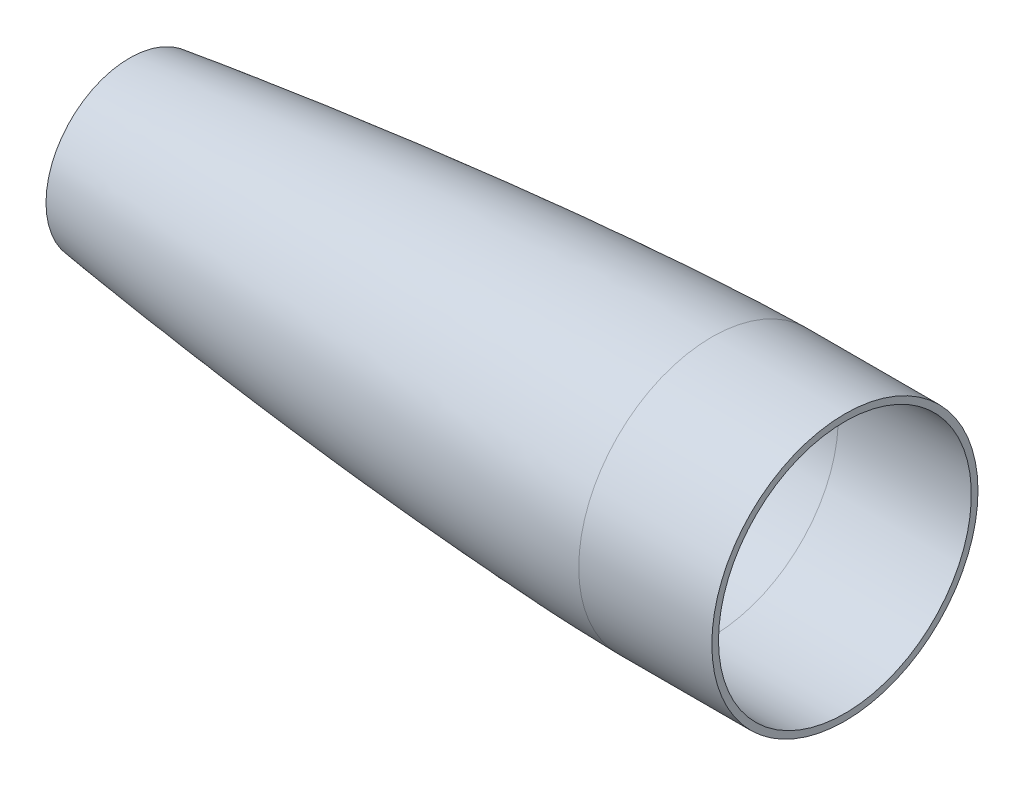
from build123d import *

# Parameters (mm, degrees)
SKETCH3_R          = 3.1
CUT_EXTRUDE1_DEPTH = 223.31734079


with BuildPart() as part:
    # Sketch2 → Revolve1 (revolve)
    with BuildSketch(Plane.XY):
        with BuildLine():
            add(Edge.make_bspline(
                [(125, 25.120191193), (127.332751625, 25.431081941), (132.331407151, 26.087565456), (140.331004574, 27.10588444), (148.997541828, 28.170567532), (157.997673527, 29.234895992), (166.997785275, 30.258604093), (175.99788006, 31.242125821), (184.997960367, 32.185617854), (193.998028035, 33.088962248), (202.664954428, 33.919819428), (210.99851948, 34.682629582), (218.665386436, 35.352459035), (225.998901833, 35.963660277), (232.998913298, 36.519926308), (239.665734713, 37.022853053), (245.999211125, 37.475811811), (251.666003322, 37.85960313), (256.999453321, 38.201234754), (261.666221352, 38.483732538), (265.999648607, 38.731455183), (269.999647247, 38.947445799), (273.66639347, 39.133060543), (276.999799587, 39.291194487), (279.999798447, 39.424786884), (282.666524002, 39.535197061), (284.999909378, 39.625181506), (286.99990888, 39.697455867), (288.999908328, 39.764500704), (290.666612895, 39.815618833), (292.333279241, 39.862775866), (293.666612296, 39.897137908), (294.999976548, 39.927604539), (295.999976496, 39.948292861), (296.999976131, 39.96663039), (297.999976806, 39.981991095), (298.999972804, 39.99470952), (299.666663128, 39.998236536), (300, 40)],
                knots=[0.421150249, 0.421150249, 0.421150249, 0.421150249, 0.444408212, 0.470975106, 0.5008465, 0.530701571, 0.560541205, 0.590366151, 0.620177045, 0.649974425, 0.679758747, 0.706223046, 0.732677549, 0.755817349, 0.778949888, 0.802075245, 0.821891307, 0.841702158, 0.85820723, 0.874708692, 0.88790726, 0.901103509, 0.914297431, 0.924191338, 0.934083923, 0.943975179, 0.950568607, 0.957161437, 0.963753667, 0.970345292, 0.973640877, 0.980231589, 0.983526714, 0.986821685, 0.9901165, 0.99341116, 0.996705662, 1, 1, 1, 1], degree=3))
            Line((125, 25.120191193), (125, 0))
            Line((125, 0), (127, 0))
            Line((127, 0), (127, 23.368217816))
            add(Edge.make_bspline(
                [(127, 23.368217816), (128.56568768, 23.575377055), (135.88942536, 24.534911993), (155.75679736, 27.020093999), (186.647560948, 30.453496137), (218.103688818, 33.367517534), (243.296405578, 35.313318367), (262.204681004, 36.552540592), (277.964515807, 37.369612833), (290.582066888, 37.830985967), (296.865005199, 37.983386836), (300.010580524, 38.000027987)],
                knots=[0.426924824, 0.426924824, 0.426924824, 0.426924824, 0.442549824, 0.5, 0.625, 0.75, 0.8125, 0.875, 0.9375, 0.96875, 1, 1, 1, 1], degree=3))
            Line((300.010580524, 38.000027987), (340, 38.000027987))
            Line((340, 38.000027987), (340, 40))
            Line((340, 40), (300, 40))
        make_face()
    revolve(axis=Axis((0, 0, 0), (1, 0, 0)))

    # Sketch3 → Cut-Extrude1 (cut, through all)
    with BuildSketch(Plane.ZY.offset(-125)):
        Circle(SKETCH3_R)
    extrude(amount=-CUT_EXTRUDE1_DEPTH, mode=Mode.SUBTRACT)


solid = part.part
